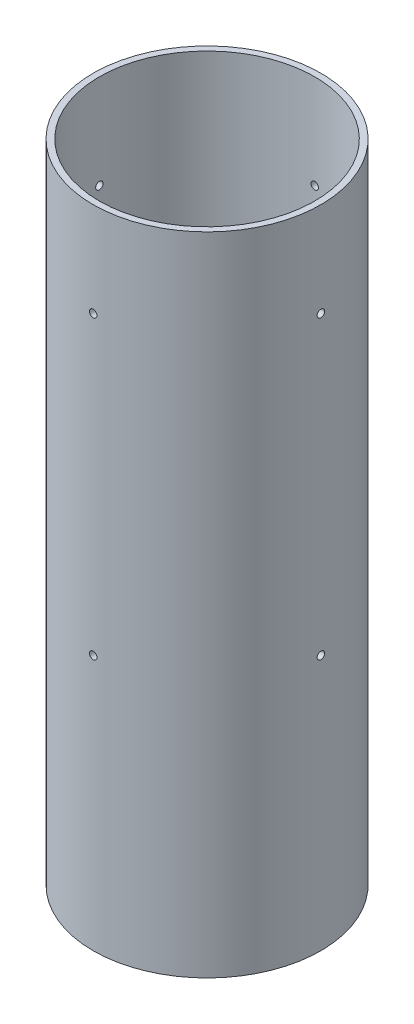
from build123d import *

# Parameters (mm, degrees)
SKETCH1_R            = 53.721
SKETCH1_R_2          = 50.8
BOSS_EXTRUDE1_DEPTH  = 304.8
SKETCH2_R            = 1.7526
BULKHEAD_HOLES_DEPTH = 127
CIRPATTERN1_COUNT    = 4
CUT_EXTRUDE1_REACH   = 329.617
SKETCH3_R            = 1.7526
CIRPATTERN2_COUNT    = 4


with BuildPart() as part:
    # Sketch1 → Boss-Extrude1 (new body)
    with BuildSketch(Plane(origin=(0, 0, 0), x_dir=(1, 0, 0), z_dir=(0, 1, 0))):
        Circle(SKETCH1_R)
        Circle(SKETCH1_R_2, mode=Mode.SUBTRACT)
    extrude(amount=BOSS_EXTRUDE1_DEPTH)

    # Sketch2 → Bulkhead Holes (cut)
    with BuildSketch(Plane.XY):
        with Locations((0, 120.65)):
            Circle(SKETCH2_R)
    bulkhead_holes = extrude(amount=-BULKHEAD_HOLES_DEPTH, mode=Mode.SUBTRACT)

    # CirPattern1: Bulkhead Holes ×4 about axis
    cirpattern1_axis = Axis((0, 304.8, 0), (0, -1, 0))
    for i in range(1, CIRPATTERN1_COUNT):
        add(bulkhead_holes.rotate(cirpattern1_axis, i * 360 / CIRPATTERN1_COUNT), mode=Mode.SUBTRACT)

    # Sketch3 → Cut-Extrude1 (cut, up to next)
    with BuildSketch(Plane(origin=(53.721, 0, 0), x_dir=(0, 0, -1), z_dir=(1, 0, 0)), mode=Mode.PRIVATE) as cut_extrude1_sk1:
        with Locations((0, 260.35)):
            Circle(SKETCH3_R)
    cut_extrude1_tool1 = extrude(cut_extrude1_sk1.sketch, amount=-CUT_EXTRUDE1_REACH, mode=Mode.PRIVATE) & part.part
    cut_extrude1 = cut_extrude1_tool1.solids().sort_by_distance((53.721, 260.35, 0))[0]
    add(cut_extrude1, mode=Mode.SUBTRACT)

    # CirPattern2: Cut-Extrude1 ×4 about axis
    cirpattern2_axis = Axis((0, 304.8, 0), (0, -1, 0))
    for i in range(1, CIRPATTERN2_COUNT):
        add(cut_extrude1.rotate(cirpattern2_axis, i * 360 / CIRPATTERN2_COUNT), mode=Mode.SUBTRACT)


solid = part.part
